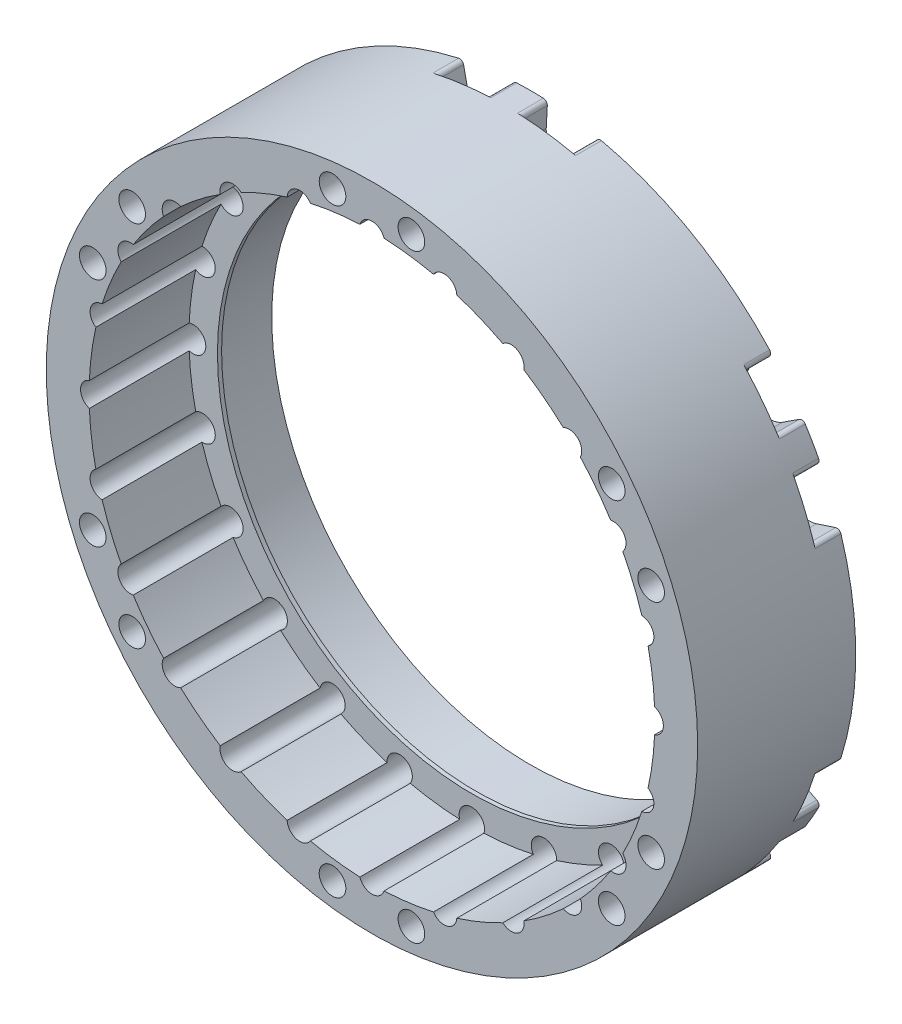
from build123d import *
from build123d.topology import SkipClean

# Parameters (mm, degrees)
CYC_MASTER_SKETCH_R            = 39.15
CYC_MASTER_SKETCH_R_2          = 1.6
GEARBOX_WALL_DEPTH             = 19
CYC_MASTER_SKETCH_3_R          = 1.525
CYC_MASTER_SKETCH_3_R_2        = 34
GEARBOX_BOTTOM_DEPTH           = 7
PIN_START                      = 3
PIN_CUT_OUTLINE_R              = 1.525
PIN_CUT_DEPTH                  = 4
SKETCH2_R                      = 31.05
HOUSING_BEARING_CUT_DEPTH      = 57.651963779
SKETCH3_R                      = 31.05
SKETCH3_R_2                    = 30.575
HOUSING_BEARING_RETAINER_DEPTH = 0.5
M3_SOCKET_HEAD_CUTOUT_DEPTH    = 3.1
FILLET1_R                      = 0.5


# Read off the part's stored shape, not the designer's step: Pin Cut
with BuildPart() as part:
    # CYC Master Sketch → Gearbox Wall (new body)
    with BuildSketch(Plane.XY):
        Circle(CYC_MASTER_SKETCH_R)
        with Locations((-28.818560086, -22.113258909)):
            Circle(CYC_MASTER_SKETCH_R_2, mode=Mode.SUBTRACT)
        with Locations((-4.741363932, -36.014234589)):
            Circle(CYC_MASTER_SKETCH_R_2, mode=Mode.SUBTRACT)
        with Locations((-33.559924018, -13.900975681)):
            Circle(CYC_MASTER_SKETCH_R_2, mode=Mode.SUBTRACT)
        with Locations((4.741363932, -36.014234589)):
            Circle(CYC_MASTER_SKETCH_R_2, mode=Mode.SUBTRACT)
        with Locations((28.818560086, -22.113258909)):
            Circle(CYC_MASTER_SKETCH_R_2, mode=Mode.SUBTRACT)
        with Locations((33.559924018, -13.900975681)):
            Circle(CYC_MASTER_SKETCH_R_2, mode=Mode.SUBTRACT)
        with Locations((-33.559924018, 13.900975681)):
            Circle(CYC_MASTER_SKETCH_R_2, mode=Mode.SUBTRACT)
        with Locations((-28.818560086, 22.113258909)):
            Circle(CYC_MASTER_SKETCH_R_2, mode=Mode.SUBTRACT)
        with Locations((-4.741363932, 36.014234589)):
            Circle(CYC_MASTER_SKETCH_R_2, mode=Mode.SUBTRACT)
        with BuildLine():
            ThreePointArc((-33.969020522, -1.451083991), (-35.025, 0), (-33.969020522, 1.451083991))
            ThreePointArc((-33.969020522, 1.451083991), (-33.709125287, 4.437890535), (-33.187122389, 7.390189951))
            ThreePointArc((-33.187122389, 7.390189951), (-33.831552066, 9.065137055), (-32.435986043, 10.193468958))
            ThreePointArc((-32.435986043, 10.193468958), (-31.411904105, 13.0112367), (-30.14357671, 15.727834662))
            ThreePointArc((-30.14357671, 15.727834662), (-30.332539768, 17.5125), (-28.692492718, 18.241185861))
            ThreePointArc((-28.692492718, 18.241185861), (-26.97401357, 20.697888586), (-25.045796092, 22.993653431))
            ThreePointArc((-25.045796092, 22.993653431), (-24.766415011, 24.766415011), (-22.993653431, 25.045796092))
            ThreePointArc((-22.993653431, 25.045796092), (-20.697888586, 26.97401357), (-18.241185861, 28.692492718))
            ThreePointArc((-18.241185861, 28.692492718), (-17.5125, 30.332539768), (-15.727834662, 30.14357671))
            ThreePointArc((-15.727834662, 30.14357671), (-13.0112367, 31.411904105), (-10.193468958, 32.435986043))
            ThreePointArc((-10.193468958, 32.435986043), (-9.065137055, 33.831552066), (-7.390189951, 33.187122389))
            ThreePointArc((-7.390189951, 33.187122389), (-4.437890535, 33.709125287), (-1.451083991, 33.969020522))
            ThreePointArc((-1.451083991, 33.969020522), (0, 35.025), (1.451083991, 33.969020522))
            ThreePointArc((1.451083991, 33.969020522), (4.437890535, 33.709125287), (7.390189951, 33.187122389))
            ThreePointArc((7.390189951, 33.187122389), (9.065137055, 33.831552066), (10.193468958, 32.435986043))
            ThreePointArc((10.193468958, 32.435986043), (13.0112367, 31.411904105), (15.727834662, 30.14357671))
            ThreePointArc((15.727834662, 30.14357671), (17.369202253, 30.405484253), (18.275, 29.011851027))
            ThreePointArc((18.275, 29.011851027), (18.266522904, 28.851279294), (18.241185861, 28.692492718))
            ThreePointArc((18.241185861, 28.692492718), (20.697888586, 26.97401357), (22.993653431, 25.045796092))
            ThreePointArc((22.993653431, 25.045796092), (24.4838877, 24.988965559), (25.21307717, 23.68807717))
            ThreePointArc((25.21307717, 23.68807717), (25.170667193, 23.330933191), (25.045796092, 22.993653431))
            ThreePointArc((25.045796092, 22.993653431), (26.97401357, 20.697888586), (28.692492718, 18.241185861))
            ThreePointArc((28.692492718, 18.241185861), (29.970653295, 17.93588499), (30.536851027, 16.75))
            ThreePointArc((30.536851027, 16.75), (30.435140644, 16.202394607), (30.14357671, 15.727834662))
            ThreePointArc((30.14357671, 15.727834662), (31.411904105, 13.0112367), (32.435986043, 10.193468958))
            ThreePointArc((32.435986043, 10.193468958), (33.463903815, 9.721028782), (33.883515181, 8.670438011))
            ThreePointArc((33.883515181, 8.670438011), (33.698151511, 7.941740884), (33.187122389, 7.390189951))
            ThreePointArc((33.187122389, 7.390189951), (33.709125287, 4.437890535), (33.969020522, 1.451083991))
            ThreePointArc((33.969020522, 1.451083991), (34.733061494, 0.897320652), (35.025, 0))
            ThreePointArc((35.025, 0), (34.733061494, -0.897320652), (33.969020522, -1.451083991))
            ThreePointArc((33.969020522, -1.451083991), (33.709125287, -4.437890535), (33.187122389, -7.390189951))
            ThreePointArc((33.187122389, -7.390189951), (33.698151511, -7.941740884), (33.883515181, -8.670438011))
            ThreePointArc((33.883515181, -8.670438011), (33.463903815, -9.721028782), (32.435986043, -10.193468958))
            ThreePointArc((32.435986043, -10.193468958), (31.411904105, -13.0112367), (30.14357671, -15.727834662))
            ThreePointArc((30.14357671, -15.727834662), (30.435140644, -16.202394607), (30.536851027, -16.75))
            ThreePointArc((30.536851027, -16.75), (29.970653295, -17.93588499), (28.692492718, -18.241185861))
            ThreePointArc((28.692492718, -18.241185861), (26.97401357, -20.697888586), (25.045796092, -22.993653431))
            ThreePointArc((25.045796092, -22.993653431), (25.170667193, -23.330933191), (25.21307717, -23.68807717))
            ThreePointArc((25.21307717, -23.68807717), (24.4838877, -24.988965559), (22.993653431, -25.045796092))
            ThreePointArc((22.993653431, -25.045796092), (20.697888586, -26.97401357), (18.241185861, -28.692492718))
            ThreePointArc((18.241185861, -28.692492718), (18.266522904, -28.851279294), (18.275, -29.011851027))
            ThreePointArc((18.275, -29.011851027), (17.369202253, -30.405484253), (15.727834662, -30.14357671))
            ThreePointArc((15.727834662, -30.14357671), (13.0112367, -31.411904105), (10.193468958, -32.435986043))
            ThreePointArc((10.193468958, -32.435986043), (9.065137055, -33.831552066), (7.390189951, -33.187122389))
            ThreePointArc((7.390189951, -33.187122389), (4.437890535, -33.709125287), (1.451083991, -33.969020522))
            ThreePointArc((1.451083991, -33.969020522), (0, -35.025), (-1.451083991, -33.969020522))
            ThreePointArc((-1.451083991, -33.969020522), (-4.437890535, -33.709125287), (-7.390189951, -33.187122389))
            ThreePointArc((-7.390189951, -33.187122389), (-9.065137055, -33.831552066), (-10.193468958, -32.435986043))
            ThreePointArc((-10.193468958, -32.435986043), (-13.0112367, -31.411904105), (-15.727834662, -30.14357671))
            ThreePointArc((-15.727834662, -30.14357671), (-17.5125, -30.332539768), (-18.241185861, -28.692492718))
            ThreePointArc((-18.241185861, -28.692492718), (-20.697888586, -26.97401357), (-22.993653431, -25.045796092))
            ThreePointArc((-22.993653431, -25.045796092), (-24.766415011, -24.766415011), (-25.045796092, -22.993653431))
            ThreePointArc((-25.045796092, -22.993653431), (-26.97401357, -20.697888586), (-28.692492718, -18.241185861))
            ThreePointArc((-28.692492718, -18.241185861), (-30.332539768, -17.5125), (-30.14357671, -15.727834662))
            ThreePointArc((-30.14357671, -15.727834662), (-31.411904105, -13.0112367), (-32.435986043, -10.193468958))
            ThreePointArc((-32.435986043, -10.193468958), (-33.831552066, -9.065137055), (-33.187122389, -7.390189951))
            ThreePointArc((-33.187122389, -7.390189951), (-33.709125287, -4.437890535), (-33.969020522, -1.451083991))
        make_face(mode=Mode.SUBTRACT)
        with Locations((33.559924018, 13.900975681)):
            Circle(CYC_MASTER_SKETCH_R_2, mode=Mode.SUBTRACT)
        with Locations((4.741363932, 36.014234589)):
            Circle(CYC_MASTER_SKETCH_R_2, mode=Mode.SUBTRACT)
        with Locations((28.818560086, 22.113258909)):
            Circle(CYC_MASTER_SKETCH_R_2, mode=Mode.SUBTRACT)
    extrude(amount=GEARBOX_WALL_DEPTH)

    # CYC Master Sketch<3> → Gearbox Bottom (add)
    with BuildSketch(Plane.XY):
        with Locations((0, -33.5)):
            Circle(CYC_MASTER_SKETCH_3_R)
        Circle(CYC_MASTER_SKETCH_3_R_2)
        with Locations((8.670438011, -32.358515181)):
            Circle(CYC_MASTER_SKETCH_3_R)
        with Locations((16.75, -29.011851027)):
            Circle(CYC_MASTER_SKETCH_3_R)
        with Locations((23.68807717, -23.68807717)):
            Circle(CYC_MASTER_SKETCH_3_R)
        with Locations((29.011851027, -16.75)):
            Circle(CYC_MASTER_SKETCH_3_R)
        with Locations((32.358515181, -8.670438011)):
            Circle(CYC_MASTER_SKETCH_3_R)
        with Locations((33.5, 0)):
            Circle(CYC_MASTER_SKETCH_3_R)
        with Locations((32.358515181, 8.670438011)):
            Circle(CYC_MASTER_SKETCH_3_R)
        with Locations((29.011851027, 16.75)):
            Circle(CYC_MASTER_SKETCH_3_R)
        with Locations((23.68807717, 23.68807717)):
            Circle(CYC_MASTER_SKETCH_3_R)
        with Locations((16.75, 29.011851027)):
            Circle(CYC_MASTER_SKETCH_3_R)
        with Locations((8.670438011, 32.358515181)):
            Circle(CYC_MASTER_SKETCH_3_R)
        with Locations((0, 33.5)):
            Circle(CYC_MASTER_SKETCH_3_R)
        with Locations((-8.670438011, 32.358515181)):
            Circle(CYC_MASTER_SKETCH_3_R)
        with Locations((-16.75, 29.011851027)):
            Circle(CYC_MASTER_SKETCH_3_R)
        with Locations((-23.68807717, 23.68807717)):
            Circle(CYC_MASTER_SKETCH_3_R)
        with Locations((-29.011851027, 16.75)):
            Circle(CYC_MASTER_SKETCH_3_R)
        with Locations((-32.358515181, 8.670438011)):
            Circle(CYC_MASTER_SKETCH_3_R)
        with Locations((-33.5, 0)):
            Circle(CYC_MASTER_SKETCH_3_R)
        with Locations((-8.670438011, -32.358515181)):
            Circle(CYC_MASTER_SKETCH_3_R)
        with Locations((-16.75, -29.011851027)):
            Circle(CYC_MASTER_SKETCH_3_R)
        with Locations((-23.68807717, -23.68807717)):
            Circle(CYC_MASTER_SKETCH_3_R)
        with Locations((-29.011851027, -16.75)):
            Circle(CYC_MASTER_SKETCH_3_R)
        with Locations((-32.358515181, -8.670438011)):
            Circle(CYC_MASTER_SKETCH_3_R)
    extrude(amount=GEARBOX_BOTTOM_DEPTH)

    # Pin Cut outline → Pin Cut (cut)
    with SkipClean():  # the faces are left unmerged after this step: merging them gives an invalid solid
        with BuildSketch(Plane.XY.offset(PIN_START)):
            with Locations((-32.358515181, -8.670438011)):
                Circle(PIN_CUT_OUTLINE_R)
            with Locations((-33.5, 0)):
                Circle(PIN_CUT_OUTLINE_R)
            with Locations((-32.358515181, 8.670438011)):
                Circle(PIN_CUT_OUTLINE_R)
            with Locations((-29.011851027, 16.75)):
                Circle(PIN_CUT_OUTLINE_R)
            with Locations((-23.68807717, 23.68807717)):
                Circle(PIN_CUT_OUTLINE_R)
            with Locations((-16.75, 29.011851027)):
                Circle(PIN_CUT_OUTLINE_R)
            with Locations((-8.670438011, 32.358515181)):
                Circle(PIN_CUT_OUTLINE_R)
            with Locations((0, 33.5)):
                Circle(PIN_CUT_OUTLINE_R)
            with Locations((8.670438011, 32.358515181)):
                Circle(PIN_CUT_OUTLINE_R)
            with Locations((16.75, 29.011851027)):
                Circle(PIN_CUT_OUTLINE_R)
            with Locations((23.68807717, 23.68807717)):
                Circle(PIN_CUT_OUTLINE_R)
            with Locations((29.011851027, 16.75)):
                Circle(PIN_CUT_OUTLINE_R)
            with Locations((32.358515181, 8.670438011)):
                Circle(PIN_CUT_OUTLINE_R)
            with Locations((33.5, 0)):
                Circle(PIN_CUT_OUTLINE_R)
            with Locations((32.358515181, -8.670438011)):
                Circle(PIN_CUT_OUTLINE_R)
            with Locations((29.011851027, -16.75)):
                Circle(PIN_CUT_OUTLINE_R)
            with Locations((23.68807717, -23.68807717)):
                Circle(PIN_CUT_OUTLINE_R)
            with Locations((16.75, -29.011851027)):
                Circle(PIN_CUT_OUTLINE_R)
            with Locations((8.670438011, -32.358515181)):
                Circle(PIN_CUT_OUTLINE_R)
            with Locations((0, -33.5)):
                Circle(PIN_CUT_OUTLINE_R)
            with Locations((-8.670438011, -32.358515181)):
                Circle(PIN_CUT_OUTLINE_R)
            with Locations((-16.75, -29.011851027)):
                Circle(PIN_CUT_OUTLINE_R)
            with Locations((-23.68807717, -23.68807717)):
                Circle(PIN_CUT_OUTLINE_R)
            with Locations((-29.011851027, -16.75)):
                Circle(PIN_CUT_OUTLINE_R)
        extrude(amount=PIN_CUT_DEPTH, mode=Mode.SUBTRACT)
    add(part.part.scale(1), mode=Mode.REPLACE)  # the faces are merged on a copy

    # Sketch2 → Housing Bearing Cut (cut, through all)
    with BuildSketch(Plane.XY.offset(7)):
        Circle(SKETCH2_R)
    extrude(amount=-HOUSING_BEARING_CUT_DEPTH, mode=Mode.SUBTRACT)

    # Sketch3 → Housing Bearing Retainer (add)
    with SkipClean():  # the faces are left unmerged after this step: merging them gives an invalid solid
        with BuildSketch(Plane.XY.offset(7)):
            Circle(SKETCH3_R)
            Circle(SKETCH3_R_2, mode=Mode.SUBTRACT)
        extrude(amount=-HOUSING_BEARING_RETAINER_DEPTH)

    # Sketch5 → M3 Socket Head Cutout (cut)
    with SkipClean():  # the faces are left unmerged after this step: merging them gives an invalid solid
        with BuildSketch(Plane(origin=(0, 0, 0), x_dir=(-1, 0, 0), z_dir=(0, 0, -1))):
            with BuildLine():
                Line((34.428849334, 11.239215211), (37.217115135, 12.149437888))
                ThreePointArc((37.217115135, 12.149437888), (36.169883698, 14.982056377), (34.907424407, 17.72552457))
                Line((34.907424407, 17.72552457), (32.292198123, 16.397547541))
                ThreePointArc((32.292198123, 16.397547541), (30.973061327, 12.82946207), (34.428849334, 11.239215211))
            make_face()
            with BuildLine():
                Line((26.947870558, 24.19665054), (29.130279421, 26.156248219))
                ThreePointArc((29.130279421, 26.156248219), (31.059783272, 23.833009946), (32.804466776, 21.367954032))
                Line((32.804466776, 21.367954032), (30.346791792, 19.767090148))
                ThreePointArc((30.346791792, 19.767090148), (26.597170733, 20.408726908), (26.947870558, 24.19665054))
            make_face()
            with BuildLine():
                Line((34.428849334, -11.239215211), (37.217115135, -12.149437888))
                ThreePointArc((37.217115135, -12.149437888), (36.169883698, -14.982056377), (34.907424407, -17.72552457))
                Line((34.907424407, -17.72552457), (32.292198123, -16.397547541))
                ThreePointArc((32.292198123, -16.397547541), (30.973061327, -12.82946207), (34.428849334, -11.239215211))
            make_face()
            with BuildLine():
                Line((26.947870558, -24.19665054), (29.130279421, -26.156248219))
                ThreePointArc((29.130279421, -26.156248219), (31.059783272, -23.833009946), (32.804466776, -21.367954032))
                Line((32.804466776, -21.367954032), (30.346791792, -19.767090148))
                ThreePointArc((30.346791792, -19.767090148), (26.597170733, -20.408726908), (26.947870558, -24.19665054))
            make_face()
            with BuildLine():
                Line((7.480978775, -35.435865752), (8.086835715, -38.305686107))
                ThreePointArc((8.086835715, -38.305686107), (5.110100425, -38.815066323), (2.10295763, -39.093478602))
                Line((2.10295763, -39.093478602), (1.945406331, -36.164637689))
                ThreePointArc((1.945406331, -36.164637689), (4.375890594, -33.238188978), (7.480978775, -35.435865752))
            make_face()
            with BuildLine():
                Line((-7.480978775, -35.435865752), (-8.086835715, -38.305686107))
                ThreePointArc((-8.086835715, -38.305686107), (-5.110100425, -38.815066323), (-2.10295763, -39.093478602))
                Line((-2.10295763, -39.093478602), (-1.945406331, -36.164637689))
                ThreePointArc((-1.945406331, -36.164637689), (-4.375890594, -33.238188978), (-7.480978775, -35.435865752))
            make_face()
            with BuildLine():
                Line((-26.947870558, -24.19665054), (-29.130279421, -26.156248219))
                ThreePointArc((-29.130279421, -26.156248219), (-31.059783272, -23.833009946), (-32.804466776, -21.367954032))
                Line((-32.804466776, -21.367954032), (-30.346791792, -19.767090148))
                ThreePointArc((-30.346791792, -19.767090148), (-26.597170733, -20.408726908), (-26.947870558, -24.19665054))
            make_face()
            with BuildLine():
                Line((-34.428849334, -11.239215211), (-37.217115135, -12.149437888))
                ThreePointArc((-37.217115135, -12.149437888), (-36.169883698, -14.982056377), (-34.907424407, -17.72552457))
                Line((-34.907424407, -17.72552457), (-32.292198123, -16.397547541))
                ThreePointArc((-32.292198123, -16.397547541), (-30.973061327, -12.82946207), (-34.428849334, -11.239215211))
            make_face()
            with BuildLine():
                Line((-34.428849334, 11.239215211), (-37.217115135, 12.149437888))
                ThreePointArc((-37.217115135, 12.149437888), (-36.169883698, 14.982056377), (-34.907424407, 17.72552457))
                Line((-34.907424407, 17.72552457), (-32.292198123, 16.397547541))
                ThreePointArc((-32.292198123, 16.397547541), (-30.973061327, 12.82946207), (-34.428849334, 11.239215211))
            make_face()
            with BuildLine():
                Line((-26.947870558, 24.19665054), (-29.130279421, 26.156248219))
                ThreePointArc((-29.130279421, 26.156248219), (-31.059783272, 23.833009946), (-32.804466776, 21.367954032))
                Line((-32.804466776, 21.367954032), (-30.346791792, 19.767090148))
                ThreePointArc((-30.346791792, 19.767090148), (-26.597170733, 20.408726908), (-26.947870558, 24.19665054))
            make_face()
            with BuildLine():
                Line((-7.480978775, 35.435865752), (-8.086835715, 38.305686107))
                ThreePointArc((-8.086835715, 38.305686107), (-5.110100425, 38.815066323), (-2.10295763, 39.093478602))
                Line((-2.10295763, 39.093478602), (-1.945406331, 36.164637689))
                ThreePointArc((-1.945406331, 36.164637689), (-4.375890594, 33.238188978), (-7.480978775, 35.435865752))
            make_face()
            with BuildLine():
                Line((7.480978775, 35.435865752), (8.086835715, 38.305686107))
                ThreePointArc((8.086835715, 38.305686107), (5.110100425, 38.815066323), (2.10295763, 39.093478602))
                Line((2.10295763, 39.093478602), (1.945406331, 36.164637689))
                ThreePointArc((1.945406331, 36.164637689), (4.375890594, 33.238188978), (7.480978775, 35.435865752))
            make_face()
        extrude(amount=-M3_SOCKET_HEAD_CUTOUT_DEPTH, mode=Mode.SUBTRACT)

    # Fillet1
    fillet1_edges = [part.edges().sort_by_distance(p)[0] for p in [
        (-2.10295763, 39.093478602, 1.55),
        (-8.086835715, 38.305686107, 1.55),
        (8.086835715, 38.305686107, 1.55),
        (2.10295763, 39.093478602, 1.55),
        (32.804466776, 21.367954032, 1.55),
        (29.130279421, 26.156248219, 1.55),
        (-37.217115135, -12.149437888, 1.55),
        (-34.907424407, -17.72552457, 1.55),
        (34.907424407, -17.72552457, 1.55),
        (37.217115135, -12.149437888, 1.55),
        (29.130279421, -26.156248219, 1.55),
        (32.804466776, -21.367954032, 1.55),
        (-34.907424407, 17.72552457, 1.55),
        (-37.217115135, 12.149437888, 1.55),
        (-32.804466776, -21.367954032, 1.55),
        (-29.130279421, -26.156248219, 1.55),
        (-8.086835715, -38.305686107, 1.55),
        (-2.10295763, -39.093478602, 1.55),
        (2.10295763, -39.093478602, 1.55),
        (8.086835715, -38.305686107, 1.55),
        (37.217115135, 12.149437888, 1.55),
        (34.907424407, 17.72552457, 1.55),
        (-29.130279421, 26.156248219, 1.55),
        (-32.804466776, 21.367954032, 1.55),
    ]]
    fillet(fillet1_edges, radius=FILLET1_R)


solid = part.part
